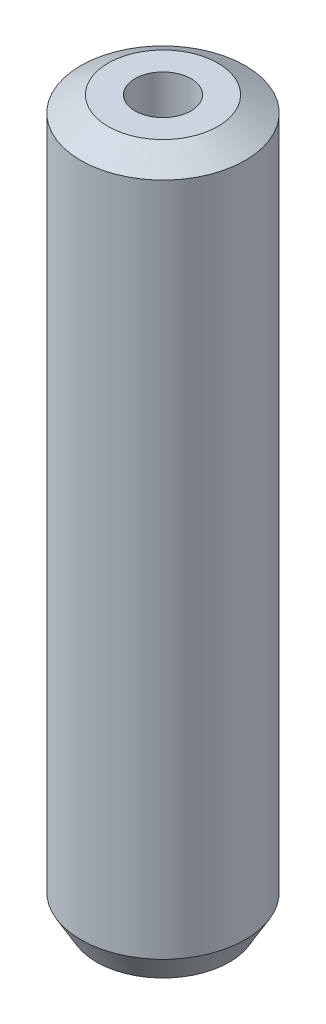
from build123d import *
from OCP.BRepFilletAPI import BRepFilletAPI_MakeChamfer

# Parameters (mm, degrees)
SKETCH1_R           = 15
BOSS_EXTRUDE1_DEPTH = 130.990104397
SKETCH2_R           = 5.108572349
CUT_EXTRUDE1_DEPTH  = 133.6966746
CHAMFER1_SIZE       = 2.87960859
CHAMFER1_SIZE2      = 4.987628385


with BuildPart() as part:
    # Sketch1 → Boss-Extrude1 (new body)
    with BuildSketch(Plane(origin=(0, 0, 0), x_dir=(1, 0, 0), z_dir=(0, 1, 0))):
        Circle(SKETCH1_R)
    extrude(amount=BOSS_EXTRUDE1_DEPTH)

    # Sketch2 → Cut-Extrude1 (cut, through all)
    with BuildSketch(Plane(origin=(0, 0, 0), x_dir=(1, 0, 0), z_dir=(0, 1, 0))):
        Circle(SKETCH2_R)
    extrude(amount=CUT_EXTRUDE1_DEPTH, mode=Mode.SUBTRACT)

    # Chamfer1: one chamfer whose edges measure the first distance from different faces: ONE call of the kernel's chamfer builder (chamfer() names one face for all edges)
    chamfer1_edges_1 = [part.edges().sort_by_distance(p)[0] for p in [
        (-15, 130.990104397, 0),
    ]]
    chamfer1_side_1 = [part.faces().sort_by_distance(p)[0] for p in [
        (-15, 65.495052199, 0),
    ]]
    chamfer1_edges_2 = [part.edges().sort_by_distance(p)[0] for p in [
        (-15, 0, 0),
    ]]
    chamfer1_side_2 = [part.faces().sort_by_distance(p)[0] for p in [
        (-14.575735931, 0, 0),
    ]]
    chamfer1 = BRepFilletAPI_MakeChamfer(part.part.solid().wrapped)
    for e in chamfer1_edges_1:
        chamfer1.Add(CHAMFER1_SIZE, CHAMFER1_SIZE2, e.wrapped, chamfer1_side_1[0].wrapped)  # the first distance lies on this face
    for e in chamfer1_edges_2:
        chamfer1.Add(CHAMFER1_SIZE, CHAMFER1_SIZE2, e.wrapped, chamfer1_side_2[0].wrapped)  # the first distance lies on this face
    add(Compound.cast(chamfer1.Shape()), mode=Mode.REPLACE)


solid = part.part
